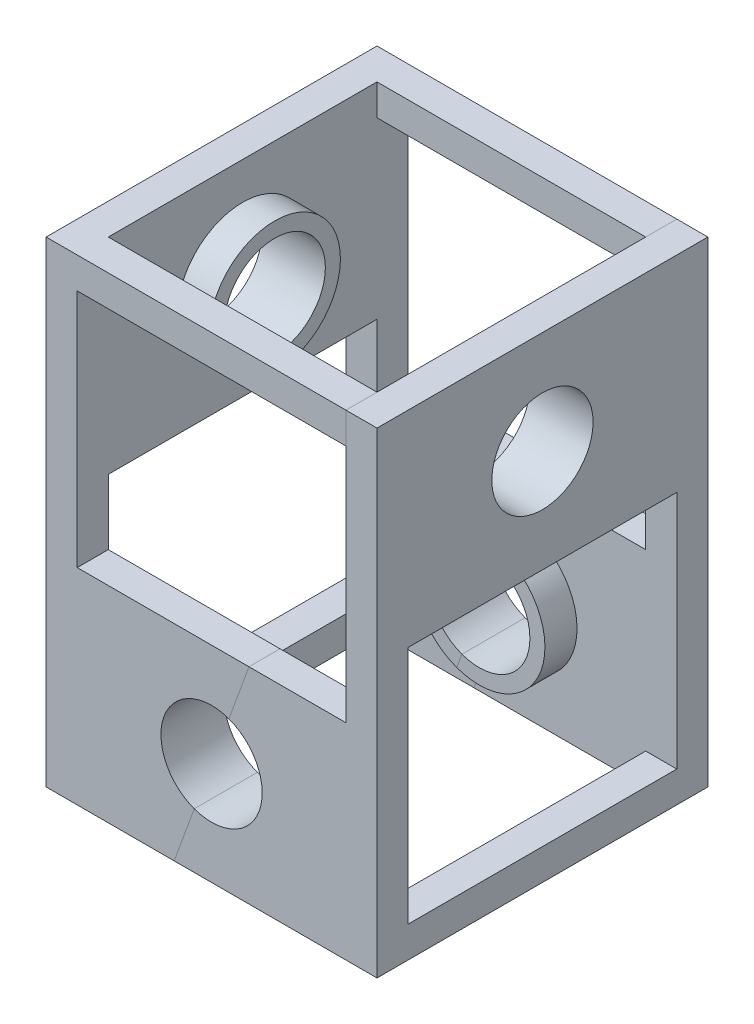
from build123d import *

# Parameters (mm, degrees)
SKETCH2_W                = 83.82
SKETCH2_H                = 83.82
BOSS_EXTRUDE1_DEPTH      = 120.65
SKETCH3_R                = 12.827
CUT_EXTRUDE1_DEPTH       = 153.769967598
SKETCH4_R                = 12.827
CUT_EXTRUDE2_DEPTH       = 153.769967598
SKETCH5_W                = 68.072
SKETCH5_H                = 68.072
CUT_EXTRUDE3_DEPTH       = 135.422165955
SKETCH6_W                = 68.072
SKETCH6_H                = 60.706
CUT_EXTRUDE4_DEPTH       = 153.769967598
SKETCH7_W                = 68.072
SKETCH7_H                = 60.706
CUT_EXTRUDE5_DEPTH       = 153.769967598
BOSS_EXTRUDE6_START      = 8.128
SKETCH18_R               = 16.637
SKETCH18_R_2             = 12.827
BOSS_EXTRUDE6_DEPTH      = 8.128
SKETCH19_R               = 16.637
SKETCH19_R_2             = 12.827
BOSS_EXTRUDE7_DEPTH      = 8.128
SKETCH20_R               = 16.637
SKETCH20_R_2             = 12.827
BOSS_EXTRUDE8_DEPTH      = 8.128
BOSS_EXTRUDE9_START      = 8.128
SKETCH21_R               = 16.637
SKETCH21_R_2             = 12.827
BOSS_EXTRUDE9_DEPTH      = 8.128
INTERSECT1_START         = -41.91
INTERSECT1_DEPTH         = 83.82
INTERSECT1_START_2       = -25.908
INTERSECT1_2_OUTLINE_W   = 8.128
INTERSECT1_2_OUTLINE_H   = 52.07
INTERSECT1_2_DEPTH       = 51.816
INTERSECT1_3_OUTLINE_W   = 7.874
INTERSECT1_3_OUTLINE_H   = 52.07
INTERSECT1_3_OUTLINE_H_2 = 7.874
INTERSECT1_3_DEPTH       = 83.82
INTERSECT1_4_DEPTH       = 7.874
INTERSECT1_START_3       = 34.036
INTERSECT1_5_DEPTH       = 7.874
INTERSECT1_START_4       = -34.036
INTERSECT1_6_DEPTH       = 8.128
INTERSECT1_START_5       = 25.908
INTERSECT1_7_DEPTH       = 8.128
INTERSECT1_8_OUTLINE_R   = 12.827
INTERSECT1_8_DEPTH       = 7.874
INTERSECT1_9_OUTLINE_R   = 16.637
INTERSECT1_9_OUTLINE_R_2 = 12.827
INTERSECT1_9_DEPTH       = 8.128


with BuildPart() as part:
    # Sketch2 → Boss-Extrude1 (new body)
    with BuildSketch(Plane(origin=(0, 0, 0), x_dir=(1, 0, 0), z_dir=(0, 1, 0))):
        Rectangle(SKETCH2_W, SKETCH2_H)
    extrude(amount=BOSS_EXTRUDE1_DEPTH)

    # Sketch3 → Cut-Extrude1 (cut, through all)
    with BuildSketch(Plane.XY.offset(41.91)):
        with Locations((0, 26.035)):
            Circle(SKETCH3_R)
    extrude(amount=-CUT_EXTRUDE1_DEPTH, mode=Mode.SUBTRACT)

    # Sketch4 → Cut-Extrude2 (cut, through all)
    with BuildSketch(Plane(origin=(41.91, 0, 0), x_dir=(0, 0, -1), z_dir=(1, 0, 0))):
        with Locations((0, 94.615)):
            Circle(SKETCH4_R)
    extrude(amount=-CUT_EXTRUDE2_DEPTH, mode=Mode.SUBTRACT)

    # Sketch5 → Cut-Extrude3 (cut, through all)
    with BuildSketch(Plane(origin=(0, 120.65, 0), x_dir=(1, 0, 0), z_dir=(0, 1, 0))):
        Rectangle(SKETCH5_W, SKETCH5_H)
    extrude(amount=-CUT_EXTRUDE3_DEPTH, mode=Mode.SUBTRACT)

    # Sketch6 → Cut-Extrude4 (cut, through all)
    with BuildSketch(Plane(origin=(41.91, 0, 0), x_dir=(0, 0, -1), z_dir=(1, 0, 0))):
        with Locations((0, 38.227)):
            Rectangle(SKETCH6_W, SKETCH6_H)
    extrude(amount=-CUT_EXTRUDE4_DEPTH, mode=Mode.SUBTRACT)

    # Sketch7 → Cut-Extrude5 (cut, through all)
    with BuildSketch(Plane.XY.offset(41.91)):
        with Locations((0, 82.423)):
            Rectangle(SKETCH7_W, SKETCH7_H)
    extrude(amount=-CUT_EXTRUDE5_DEPTH, mode=Mode.SUBTRACT)

    # Sketch18 → Boss-Extrude6 (add)
    with BuildSketch(Plane(origin=(-34.036, 0, 0), x_dir=(0, 0, -1), z_dir=(1, 0, 0)).offset(BOSS_EXTRUDE6_START)):
        with Locations(Location((0, 94.615, 0), (0, 0, 180))):
            Circle(SKETCH18_R)
        with Locations((0, 94.615)):
            Circle(SKETCH18_R_2, mode=Mode.SUBTRACT)
    extrude(amount=-BOSS_EXTRUDE6_DEPTH)

    # Sketch19 → Boss-Extrude7 (add)
    with BuildSketch(Plane.ZY.offset(-34.036)):
        with Locations((0, 94.615)):
            Circle(SKETCH19_R)
        with Locations(Location((0, 94.615, 0), (0, 0, 180))):
            Circle(SKETCH19_R_2, mode=Mode.SUBTRACT)
    extrude(amount=BOSS_EXTRUDE7_DEPTH)

    # Sketch20 → Boss-Extrude8 (add)
    with BuildSketch(Plane(origin=(0, 0, 34.036), x_dir=(-1, 0, 0), z_dir=(0, 0, -1))):
        with Locations(Location((0, 26.035, 0), (0, 0, 180))):
            Circle(SKETCH20_R)
        with Locations(Location((0, 26.035, 0), (0, 0, 180))):
            Circle(SKETCH20_R_2, mode=Mode.SUBTRACT)
    extrude(amount=BOSS_EXTRUDE8_DEPTH)

    # Sketch21 → Boss-Extrude9 (add)
    with BuildSketch(Plane.XY.offset(-34.036).offset(BOSS_EXTRUDE9_START)):
        with Locations((0, 26.035)):
            Circle(SKETCH21_R)
        with Locations((0, 26.035)):
            Circle(SKETCH21_R_2, mode=Mode.SUBTRACT)
    extrude(amount=-BOSS_EXTRUDE9_DEPTH)

    # Intersect1: read off the stored shape, not the designer's step
    # Intersect1 outline → Intersect1 (cut)
    with BuildSketch(Plane.XY.offset(INTERSECT1_START)):
        with BuildLine():
            Line((41.91, 120.65), (34.036, 120.65))
            Line((34.036, 120.65), (34.036, 52.07))
            Line((34.036, 52.07), (9.475965049, 52.07))
            Line((9.475965049, 52.07), (4.387092378, 38.088437247))
            ThreePointArc((4.387092378, 38.088437247), (12.053437247, 21.647907622), (-4.387092378, 13.981562753))
            Line((-4.387092378, 13.981562753), (-9.475965049, 0))
            Line((-9.475965049, 0), (41.91, 0))
            Line((41.91, 0), (41.91, 120.65))
        make_face()
    extrude(amount=INTERSECT1_DEPTH, mode=Mode.SUBTRACT)

    # Intersect1 2 outline → Intersect1 2 (cut)
    with BuildSketch(Plane.XY.offset(INTERSECT1_START_2)):
        with Locations((29.972, 94.615)):
            Rectangle(INTERSECT1_2_OUTLINE_W, INTERSECT1_2_OUTLINE_H)
    extrude(amount=INTERSECT1_2_DEPTH, mode=Mode.SUBTRACT)


with BuildPart() as body_2:
    # Intersect1 3 outline → Intersect1 3 (new body)
    with BuildSketch(Plane.XY.offset(INTERSECT1_START)):
        with Locations((37.973, 94.615)):
            Rectangle(INTERSECT1_3_OUTLINE_W, INTERSECT1_3_OUTLINE_H)
        with Locations((37.973, 3.937)):
            Rectangle(INTERSECT1_3_OUTLINE_W, INTERSECT1_3_OUTLINE_H_2)
    extrude(amount=INTERSECT1_3_DEPTH)

    # Intersect1 4 outline → Intersect1 4 (add)
    with BuildSketch(Plane.XY.offset(INTERSECT1_START)):
        with BuildLine():
            ThreePointArc((4.387092378, 38.088437247), (12.053437247, 21.647907622), (-4.387092378, 13.981562753))
            Line((-4.387092378, 13.981562753), (-9.475965049, 0))
            Line((-9.475965049, 0), (34.036, 0))
            Line((34.036, 0), (34.036, 7.874))
            Line((34.036, 7.874), (41.91, 7.874))
            Line((41.91, 7.874), (41.91, 68.58))
            Line((41.91, 68.58), (34.036, 68.58))
            Line((34.036, 68.58), (34.036, 52.07))
            Line((34.036, 52.07), (9.475965049, 52.07))
            Line((9.475965049, 52.07), (4.387092378, 38.088437247))
        make_face()
    extrude(amount=INTERSECT1_4_DEPTH)

    # Intersect1 5 outline → Intersect1 5 (add)
    with BuildSketch(Plane.XY.offset(INTERSECT1_START_3)):
        with BuildLine():
            ThreePointArc((4.387092378, 38.088437247), (12.053437247, 21.647907622), (-4.387092378, 13.981562753))
            Line((-4.387092378, 13.981562753), (-9.475965049, 0))
            Line((-9.475965049, 0), (34.036, 0))
            Line((34.036, 0), (34.036, 7.874))
            Line((34.036, 7.874), (41.91, 7.874))
            Line((41.91, 7.874), (41.91, 68.58))
            Line((41.91, 68.58), (34.036, 68.58))
            Line((34.036, 68.58), (34.036, 52.07))
            Line((34.036, 52.07), (9.475965049, 52.07))
            Line((9.475965049, 52.07), (4.387092378, 38.088437247))
        make_face()
    extrude(amount=INTERSECT1_5_DEPTH)

    # Intersect1 6 outline → Intersect1 6 (add)
    with BuildSketch(Plane.XY.offset(INTERSECT1_START_4)):
        with BuildLine():
            Line((5.690189125, 41.668666132), (4.387092378, 38.088437247))
            ThreePointArc((4.387092378, 38.088437247), (12.053437247, 21.647907622), (-4.387092378, 13.981562753))
            Line((-4.387092378, 13.981562753), (-5.690189125, 10.401333868))
            ThreePointArc((-5.690189125, 10.401333868), (15.633666132, 20.344810875), (5.690189125, 41.668666132))
        make_face()
    extrude(amount=INTERSECT1_6_DEPTH)

    # Intersect1 7 outline → Intersect1 7 (add)
    with BuildSketch(Plane.XY.offset(INTERSECT1_START_5)):
        with BuildLine():
            Line((5.690189125, 41.668666132), (4.387092378, 38.088437247))
            ThreePointArc((4.387092378, 38.088437247), (12.053437247, 21.647907622), (-4.387092378, 13.981562753))
            Line((-4.387092378, 13.981562753), (-5.690189125, 10.401333868))
            ThreePointArc((-5.690189125, 10.401333868), (15.633666132, 20.344810875), (5.690189125, 41.668666132))
        make_face()
    extrude(amount=INTERSECT1_7_DEPTH)

    # Intersect1 8 outline → Intersect1 8 (cut)
    with BuildSketch(Plane.YZ.offset(INTERSECT1_START_3)):
        with Locations((94.615, 0)):
            Circle(INTERSECT1_8_OUTLINE_R)
    extrude(amount=INTERSECT1_8_DEPTH, mode=Mode.SUBTRACT)

    # Intersect1 9 outline → Intersect1 9 (add)
    with BuildSketch(Plane.YZ.offset(INTERSECT1_START_5)):
        with Locations((94.615, 0)):
            Circle(INTERSECT1_9_OUTLINE_R)
        with Locations((94.615, 0)):
            Circle(INTERSECT1_9_OUTLINE_R_2, mode=Mode.SUBTRACT)
    extrude(amount=INTERSECT1_9_DEPTH)


solid = Compound([part.part, body_2.part])
